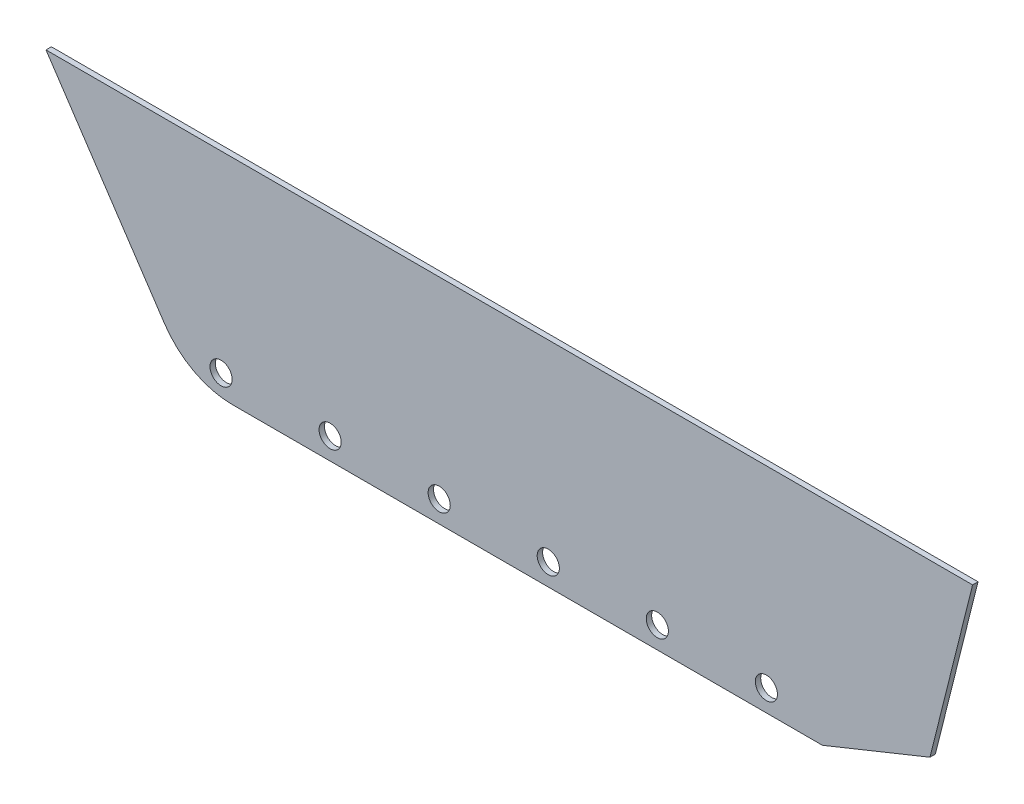
from build123d import *

# Parameters (mm, degrees)
BOSS_EXTRUDE1_DEPTH = 3.175
SKETCH1_4_R         = 6.5
CUT_EXTRUDE1_DEPTH  = 439.905857431
FILLET1_R           = 48
CUT_EXTRUDE3_DEPTH  = 10


with BuildPart() as part:
    # Sketch1 → Boss-Extrude1 (new body)
    with BuildSketch(Plane.XY):
        Polygon((-98.879411765, 3.850980392), (-31.879411765, -96.649019608), (366, -96.649019608), (403.120588235, -71.149019608), (428.120588235, 28.939617947), (-115.605170134, 28.939617947), align=None)
    extrude(amount=BOSS_EXTRUDE1_DEPTH)

    # Sketch1<4> → Cut-Extrude1 (cut, through all)
    with BuildSketch(Plane.XY):
        with Locations((-12.879411765, -83.899019608)):
            Circle(SKETCH1_4_R)
        with Locations((51.120588235, -83.899019608)):
            Circle(SKETCH1_4_R)
        with Locations((115.120588235, -83.899019608)):
            Circle(SKETCH1_4_R)
        with Locations((179.120588235, -83.899019608)):
            Circle(SKETCH1_4_R)
        with Locations((243.120588235, -83.899019608)):
            Circle(SKETCH1_4_R)
        with Locations((307.120588235, -83.899019608)):
            Circle(SKETCH1_4_R)
    extrude(amount=CUT_EXTRUDE1_DEPTH, mode=Mode.SUBTRACT)

    # Fillet1
    fillet1_edges = [part.edges().sort_by_distance(p)[0] for p in [
        (-31.879411765, -96.649019608, 1.5875),
    ]]
    fillet(fillet1_edges, radius=FILLET1_R)

    # Sketch7 → Cut-Extrude3 (cut)
    with BuildSketch(Plane.XY.offset(3.175)):
        Polygon((403.120588235, -71.149019608), (340.005873473, -96.649019608), (366, -96.649019608), align=None)
    extrude(amount=-CUT_EXTRUDE3_DEPTH, mode=Mode.SUBTRACT)


solid = part.part
